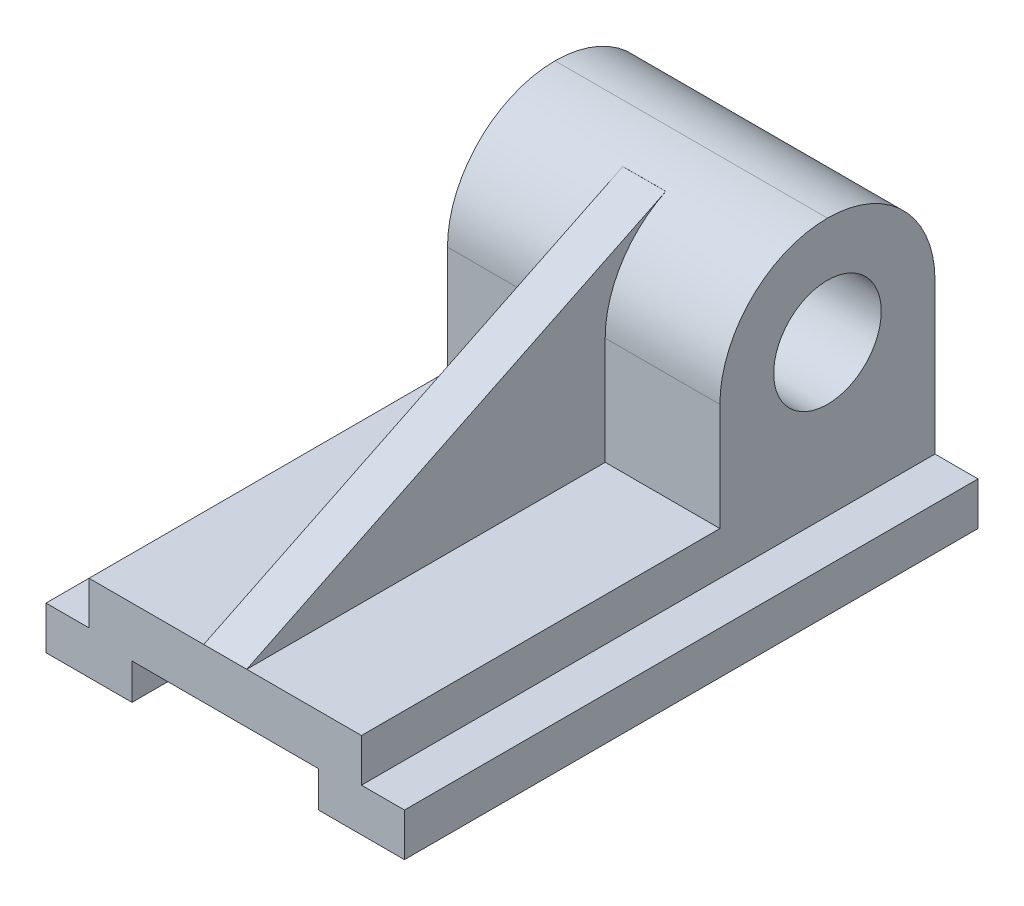
from build123d import *

# Parameters (mm, degrees)
BOSS_EXTRUDE1_DEPTH = 406.4
SKETCH3_W           = 193.04
SKETCH3_H           = 152.4
BOSS_EXTRUDE2_DEPTH = 152.4
SKETCH4_W           = 30.48
SKETCH4_H           = 254
BOSS_EXTRUDE3_DEPTH = 144.78
SKETCH5_R           = 38.1
CUT_EXTRUDE1_DEPTH  = 193.04
FILLET1_R           = 76.2
CHAMFER2_SIZE       = 144.78
CHAMFER2_SIZE2      = 296.926


with BuildPart() as part:
    # Sketch2 → Boss-Extrude1 (new body)
    with BuildSketch(Plane.XY):
        Polygon((-96.52, 5.08), (-127, 5.08), (-127, -25.4), (-66.04, -25.4), (-66.04, 0), (66.04, 0), (66.04, -25.4), (127, -25.4), (127, 5.08), (96.52, 5.08), (96.52, 35.56), (-96.52, 35.56), align=None)
    extrude(amount=BOSS_EXTRUDE1_DEPTH)

    # Sketch3 → Boss-Extrude2 (add)
    with BuildSketch(Plane(origin=(0, 35.56, 0), x_dir=(1, 0, 0), z_dir=(0, 1, 0))):
        with Locations((0, -76.2)):
            Rectangle(SKETCH3_W, SKETCH3_H)
    extrude(amount=BOSS_EXTRUDE2_DEPTH)

    # Sketch4 → Boss-Extrude3 (add)
    with BuildSketch(Plane(origin=(0, 35.56, 0), x_dir=(1, 0, 0), z_dir=(0, 1, 0))):
        with Locations((0, -279.4)):
            Rectangle(SKETCH4_W, SKETCH4_H)
    extrude(amount=BOSS_EXTRUDE3_DEPTH)

    # Sketch5 → Cut-Extrude1 (cut)
    with BuildSketch(Plane(origin=(96.52, 0, 0), x_dir=(0, 0, -1), z_dir=(1, 0, 0))):
        with Locations((-76.2, 111.76)):
            Circle(SKETCH5_R)
    extrude(amount=-CUT_EXTRUDE1_DEPTH, mode=Mode.SUBTRACT)

    # Fillet1
    # the kernel refuses this fillet: 76.2 mm, written as the material it takes off along each edge
    with BuildSketch(Plane(origin=(287.02, 187.96, 152.4), x_dir=(0, -1, 0), z_dir=(-1, 0, 0))) as fillet1_piece_1_section:
        with BuildLine():
            CenterArc((FILLET1_R, -FILLET1_R), FILLET1_R, 90, 90)
            Line((0, -FILLET1_R), (0, 0))
            Line((0, 0), (FILLET1_R, 0))
        make_face()
    fillet1_piece_1 = extrude(amount=574.04, mode=Mode.PRIVATE)
    fillet1_piece_1 = split(fillet1_piece_1, bisect_by=Plane(origin=(15.24, 162.276069746, 141.915616322), z_dir=(1, 0, 0)), keep=Keep.TOP, mode=Mode.PRIVATE)
    fillet1_piece_1 = split(fillet1_piece_1, bisect_by=Plane(origin=(151.13, 180.34, 141.915616322), z_dir=(0, -1, 0)), keep=Keep.TOP, mode=Mode.PRIVATE)
    add(fillet1_piece_1, mode=Mode.SUBTRACT)
    with BuildSketch(Plane(origin=(287.02, 187.96, 152.4), x_dir=(0, -1, 0), z_dir=(-1, 0, 0))) as fillet1_piece_2_section:
        with BuildLine():
            CenterArc((FILLET1_R, -FILLET1_R), FILLET1_R, 90, 90)
            Line((0, -FILLET1_R), (0, 0))
            Line((0, 0), (FILLET1_R, 0))
        make_face()
    fillet1_piece_2 = extrude(amount=574.04, mode=Mode.PRIVATE)
    fillet1_piece_2 = split(fillet1_piece_2, bisect_by=Plane(origin=(15.24, 185.388736326, 123.368401859), z_dir=(1, 0, 0)), keep=Keep.TOP, mode=Mode.PRIVATE)
    fillet1_piece_2 = split(fillet1_piece_2, bisect_by=Plane(origin=(151.13, 180.34, 123.368401859), z_dir=(0, 1, 0)), keep=Keep.TOP, mode=Mode.PRIVATE)
    add(fillet1_piece_2, mode=Mode.SUBTRACT)
    with BuildSketch(Plane(origin=(287.02, 187.96, 152.4), x_dir=(0, -1, 0), z_dir=(-1, 0, 0))) as fillet1_piece_3_section:
        with BuildLine():
            CenterArc((FILLET1_R, -FILLET1_R), FILLET1_R, 90, 90)
            Line((0, -FILLET1_R), (0, 0))
            Line((0, 0), (FILLET1_R, 0))
        make_face()
    fillet1_piece_3 = extrude(amount=574.04, mode=Mode.PRIVATE)
    fillet1_piece_3 = split(fillet1_piece_3, bisect_by=Plane(origin=(15.24, 185.388736326, 123.368401859), z_dir=(-1, 0, 0)), keep=Keep.TOP, mode=Mode.PRIVATE)
    fillet1_piece_3 = split(fillet1_piece_3, bisect_by=Plane(origin=(0, 180.34, 123.368401859), z_dir=(0, 1, 0)), keep=Keep.TOP, mode=Mode.PRIVATE)
    fillet1_piece_3 = split(fillet1_piece_3, bisect_by=Plane(origin=(-15.24, 185.388736326, 123.368401859), z_dir=(1, 0, 0)), keep=Keep.TOP, mode=Mode.PRIVATE)
    add(fillet1_piece_3, mode=Mode.SUBTRACT)
    with BuildSketch(Plane(origin=(287.02, 187.96, 152.4), x_dir=(0, -1, 0), z_dir=(-1, 0, 0))) as fillet1_piece_4_section:
        with BuildLine():
            CenterArc((FILLET1_R, -FILLET1_R), FILLET1_R, 90, 90)
            Line((0, -FILLET1_R), (0, 0))
            Line((0, 0), (FILLET1_R, 0))
        make_face()
    fillet1_piece_4 = extrude(amount=574.04, mode=Mode.PRIVATE)
    fillet1_piece_4 = split(fillet1_piece_4, bisect_by=Plane(origin=(-151.13, 180.34, 141.915616322), z_dir=(0, -1, 0)), keep=Keep.TOP, mode=Mode.PRIVATE)
    fillet1_piece_4 = split(fillet1_piece_4, bisect_by=Plane(origin=(-15.24, 162.276069746, 141.915616322), z_dir=(-1, 0, 0)), keep=Keep.TOP, mode=Mode.PRIVATE)
    add(fillet1_piece_4, mode=Mode.SUBTRACT)
    with BuildSketch(Plane(origin=(287.02, 187.96, 152.4), x_dir=(0, -1, 0), z_dir=(-1, 0, 0))) as fillet1_piece_5_section:
        with BuildLine():
            CenterArc((FILLET1_R, -FILLET1_R), FILLET1_R, 90, 90)
            Line((0, -FILLET1_R), (0, 0))
            Line((0, 0), (FILLET1_R, 0))
        make_face()
    fillet1_piece_5 = extrude(amount=574.04, mode=Mode.PRIVATE)
    fillet1_piece_5 = split(fillet1_piece_5, bisect_by=Plane(origin=(-151.13, 180.34, 123.368401859), z_dir=(0, 1, 0)), keep=Keep.TOP, mode=Mode.PRIVATE)
    fillet1_piece_5 = split(fillet1_piece_5, bisect_by=Plane(origin=(-15.24, 185.388736326, 123.368401859), z_dir=(-1, 0, 0)), keep=Keep.TOP, mode=Mode.PRIVATE)
    add(fillet1_piece_5, mode=Mode.SUBTRACT)
    with BuildSketch(Plane(origin=(-287.02, 187.96, 0), x_dir=(0, -1, 0), z_dir=(1, 0, 0))) as fillet1_piece_6:
        with BuildLine():
            CenterArc((FILLET1_R, -FILLET1_R), FILLET1_R, 90, 90)
            Line((0, -FILLET1_R), (0, 0))
            Line((0, 0), (FILLET1_R, 0))
        make_face()
    extrude(amount=574.04, mode=Mode.SUBTRACT)

    # Chamfer2
    chamfer2_edges = [part.edges().sort_by_distance(p)[0] for p in [
        (0, 180.34, 406.4),
    ]]
    chamfer2_side = [part.faces().sort_by_distance(p)[0] for p in [
        (0, 38.129015817, 406.4),
    ]]
    chamfer(chamfer2_edges, length=CHAMFER2_SIZE, length2=CHAMFER2_SIZE2, reference=chamfer2_side[0])


solid = part.part
